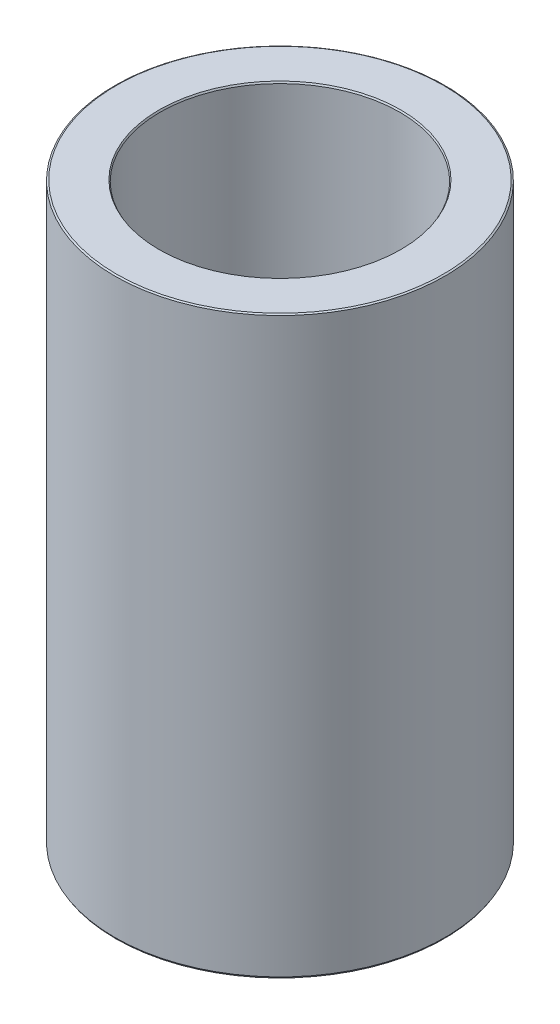
from build123d import *
from OCP.BRepFilletAPI import BRepFilletAPI_MakeChamfer

# Parameters (mm, degrees)
SKETCH1_R           = 52.5
BOSS_EXTRUDE1_DEPTH = 182.937425126
SKETCH2_R           = 38.172906411
CUT_EXTRUDE1_DEPTH  = 198.429991419
CHAMFER1_SIZE       = 0.290136479
CHAMFER1_SIZE2      = 0.502531123


with BuildPart() as part:
    # Sketch1 → Boss-Extrude1 (new body)
    with BuildSketch(Plane(origin=(0, 0, 0), x_dir=(1, 0, 0), z_dir=(0, 1, 0))):
        Circle(SKETCH1_R)
    extrude(amount=BOSS_EXTRUDE1_DEPTH)

    # Sketch2 → Cut-Extrude1 (cut, through all)
    with BuildSketch(Plane(origin=(0, 0, 0), x_dir=(1, 0, 0), z_dir=(0, 1, 0))):
        Circle(SKETCH2_R)
    extrude(amount=CUT_EXTRUDE1_DEPTH, mode=Mode.SUBTRACT)

    # Chamfer1: one chamfer whose edges measure the first distance from different faces: ONE call of the kernel's chamfer builder (chamfer() names one face for all edges)
    chamfer1_edges_1 = [part.edges().sort_by_distance(p)[0] for p in [
        (-38.172906411, 182.937425126, 0),
    ]]
    chamfer1_side_1 = [part.faces().sort_by_distance(p)[0] for p in [
        (-51.01507576, 182.937425126, 0),
    ]]
    chamfer1_edges_2 = [part.edges().sort_by_distance(p)[0] for p in [
        (-38.172906411, 0, 0),
    ]]
    chamfer1_side_2 = [part.faces().sort_by_distance(p)[0] for p in [
        (-38.172906411, 91.468712563, 0),
    ]]
    chamfer1_edges_3 = [part.edges().sort_by_distance(p)[0] for p in [
        (-52.5, 0, 0),
    ]]
    chamfer1_side_3 = [part.faces().sort_by_distance(p)[0] for p in [
        (-51.01507576, 0, 0),
    ]]
    chamfer1_edges_4 = [part.edges().sort_by_distance(p)[0] for p in [
        (-52.5, 182.937425126, 0),
    ]]
    chamfer1_side_4 = [part.faces().sort_by_distance(p)[0] for p in [
        (-52.5, 91.468712563, 0),
    ]]
    chamfer1 = BRepFilletAPI_MakeChamfer(part.part.solid().wrapped)
    for e in chamfer1_edges_1:
        chamfer1.Add(CHAMFER1_SIZE, CHAMFER1_SIZE2, e.wrapped, chamfer1_side_1[0].wrapped)  # the first distance lies on this face
    for e in chamfer1_edges_2:
        chamfer1.Add(CHAMFER1_SIZE, CHAMFER1_SIZE2, e.wrapped, chamfer1_side_2[0].wrapped)  # the first distance lies on this face
    for e in chamfer1_edges_3:
        chamfer1.Add(CHAMFER1_SIZE, CHAMFER1_SIZE2, e.wrapped, chamfer1_side_3[0].wrapped)  # the first distance lies on this face
    for e in chamfer1_edges_4:
        chamfer1.Add(CHAMFER1_SIZE, CHAMFER1_SIZE2, e.wrapped, chamfer1_side_4[0].wrapped)  # the first distance lies on this face
    add(Compound.cast(chamfer1.Shape()), mode=Mode.REPLACE)


solid = part.part
